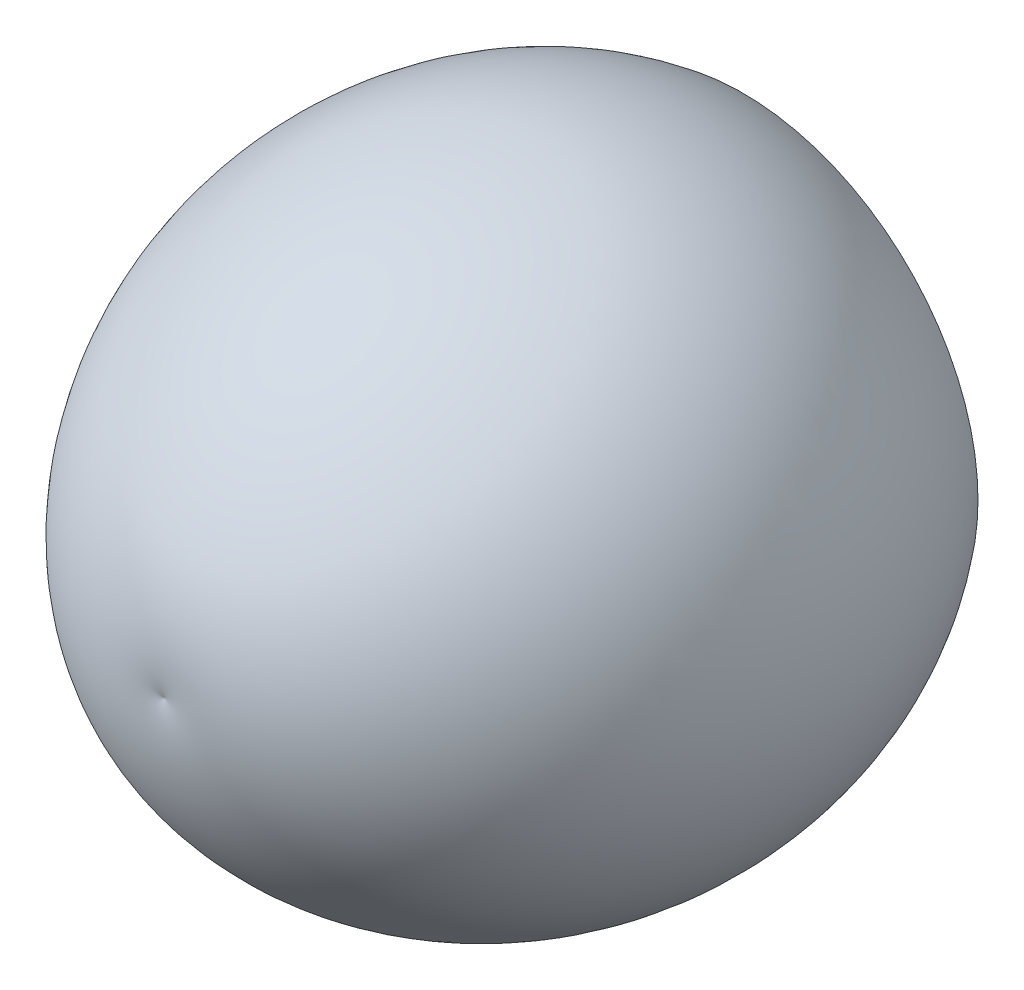
from build123d import *


with BuildPart() as part:
    # Sketch1 → Revolve1 (revolve)
    with BuildSketch(Plane(origin=(0, 0, 0), x_dir=(1, 0, 0), z_dir=(0, 1, 0))):
        with BuildLine():
            Line((106.696233767, 262.701929072), (0, 262.701929072))
            Line((0, 262.701929072), (0, 0))
            add(Edge.make_bspline(
                [(0, 0), (0.043830976, -0.018679136), (0.131974544, -0.054837862), (0.310227635, -0.122268555), (0.670407337, -0.246977058), (1.17142801, -0.400964353), (1.815615813, -0.574205655), (2.750859904, -0.792416214), (3.888245832, -1.01274692), (5.229195517, -1.218398889), (6.773949318, -1.392849423), (8.72532478, -1.544578317), (11.084284771, -1.62818225), (13.644119342, -1.600154844), (16.398680634, -1.446376571), (19.528153919, -1.15489532), (23.024388255, -0.682393984), (27.07306049, 0.061587258), (32.793677156, 1.422364752), (39.543002431, 3.490898608), (47.224529114, 6.467351474), (57.556292794, 11.436384869), (69.402736969, 18.571028551), (82.296720299, 28.372505494), (95.619918234, 41.279577467), (107.563224067, 55.860947248), (117.827965424, 71.665879724), (126.341324726, 88.477313347), (133.036982052, 106.090936875), (137.252240905, 122.030733415), (139.657409359, 135.946181249), (140.841675986, 147.647372298), (141.291720367, 157.045426617), (141.233130838, 167.630271044), (140.429876368, 179.36735911), (138.941593195, 189.854188374), (137.020196404, 199.065653139), (135.258491665, 205.896350548), (133.955832388, 210.41516403), (132.525161651, 214.895091141), (130.966717722, 219.332220248), (129.280902335, 223.722506087), (127.694710364, 227.51955736), (126.256215149, 230.739744238), (124.75469901, 233.931037787), (123.451366323, 236.565139378), (122.095661561, 239.173327922), (120.407390083, 242.26913684), (118.656323389, 245.33191257), (116.830397081, 248.347471588), (114.925598842, 251.319153062), (113.292165698, 253.75734764), (112.115819327, 255.454750298), (111.101943835, 256.880227694), (110.202837031, 258.114214129), (109.493385846, 259.0756771), (108.670260495, 260.164838088), (107.969459905, 261.083221773), (107.245854497, 262.007379495), (106.881328517, 262.469058983), (106.696233767, 262.701929072)],
                knots=[0, 0, 0, 0, 0, 0.000496676, 0.000993352, 0.001986704, 0.003973409, 0.005960113, 0.007946817, 0.011997925, 0.016049033, 0.020100141, 0.024151249, 0.032400789, 0.040650329, 0.04677887, 0.052907411, 0.065164493, 0.077420581, 0.089676669, 0.114189812, 0.138702405, 0.163215231, 0.209093252, 0.258118854, 0.307144114, 0.356169608, 0.405195108, 0.454220504, 0.503245934, 0.552271368, 0.576784106, 0.601296843, 0.62580956, 0.650322278, 0.687091361, 0.723860441, 0.7361168, 0.748373159, 0.760629519, 0.77288588, 0.785142241, 0.797398601, 0.80965496, 0.815783139, 0.821911318, 0.834167677, 0.840295856, 0.846424035, 0.858680391, 0.870936747, 0.877064925, 0.883193103, 0.889321281, 0.89238537, 0.895449458, 0.898861033, 0.902272608, 0.905684183, 0.909095758, 0.909095758, 0.909095758, 0.909095758, 0.909095758], degree=4))
        make_face()
    revolve(axis=Axis((0, 0, 737.298070928), (0, 0, -1)))


solid = part.part
